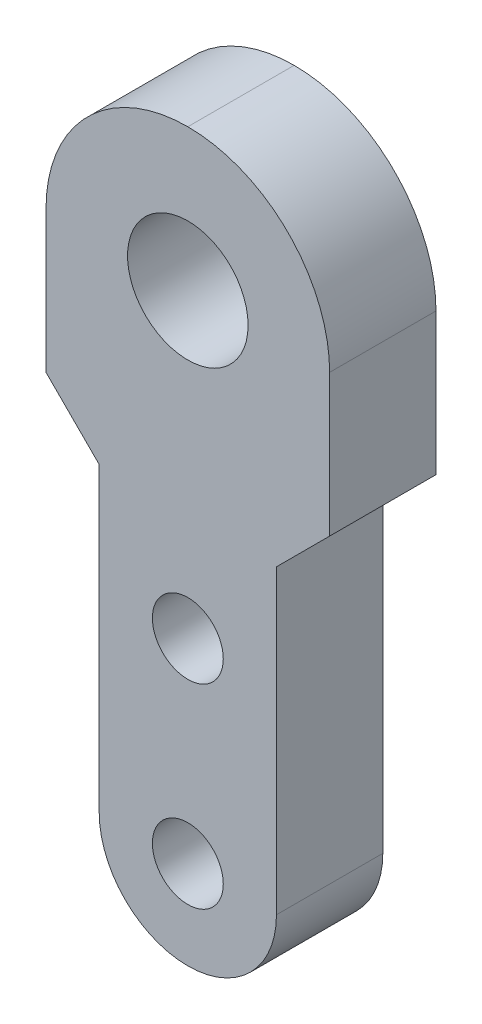
from build123d import *

# Parameters (mm, degrees)
ESQUISSE1_W             = 10
ESQUISSE1_H             = 25
BOSS_EXTRU_1_DEPTH      = 6
ESQUISSE2_W             = 16
ESQUISSE2_H             = 16
BOSS_EXTRU_2_DEPTH      = 6
ESQUISSE3_R             = 3.4
ESQUISSE3_R_2           = 2
ENL_V_MAT_EXTRU_1_DEPTH = 44.428101501
CONG_1_R                = 8
CHANFREIN1_SIZE         = 3
CONG_2_R                = 5


with BuildPart() as part:
    # Esquisse1 → Boss.-Extru.1 (new body)
    with BuildSketch(Plane.XY):
        with Locations((5, 12.5)):
            Rectangle(ESQUISSE1_W, ESQUISSE1_H)
    extrude(amount=BOSS_EXTRU_1_DEPTH)

    # Esquisse2 → Boss.-Extru.2 (add)
    with BuildSketch(Plane.XY.offset(6)):
        with Locations((5, 33)):
            Rectangle(ESQUISSE2_W, ESQUISSE2_H)
    extrude(amount=-BOSS_EXTRU_2_DEPTH)

    # Esquisse3 → Enlèv. mat.-Extru.1 (cut, through all)
    with BuildSketch(Plane.XY.offset(6)):
        with Locations((5, 33)):
            Circle(ESQUISSE3_R)
        with Locations((5, 16)):
            Circle(ESQUISSE3_R_2)
        with Locations((5, 5)):
            Circle(ESQUISSE3_R_2)
    extrude(amount=-ENL_V_MAT_EXTRU_1_DEPTH, mode=Mode.SUBTRACT)

    # Congé1
    cong_1_edges = [part.edges().sort_by_distance(p)[0] for p in [
        (13, 41, 3),
        (-3, 41, 3),
    ]]
    fillet(cong_1_edges, radius=CONG_1_R - 0.0001)  # a hair under: the kernel refuses the full size

    # Chanfrein1
    chanfrein1_edges = [part.edges().sort_by_distance(p)[0] for p in [
        (10, 25, 3),
        (0, 25, 3),
    ]]
    chamfer(chanfrein1_edges, length=CHANFREIN1_SIZE - 0.0001)  # a hair under: the kernel refuses the full size

    # Congé2
    cong_2_edges = [part.edges().sort_by_distance(p)[0] for p in [
        (10, 0, 3),
        (0, 0, 3),
    ]]
    fillet(cong_2_edges, radius=CONG_2_R - 0.0001)  # a hair under: the kernel refuses the full size


solid = part.part
